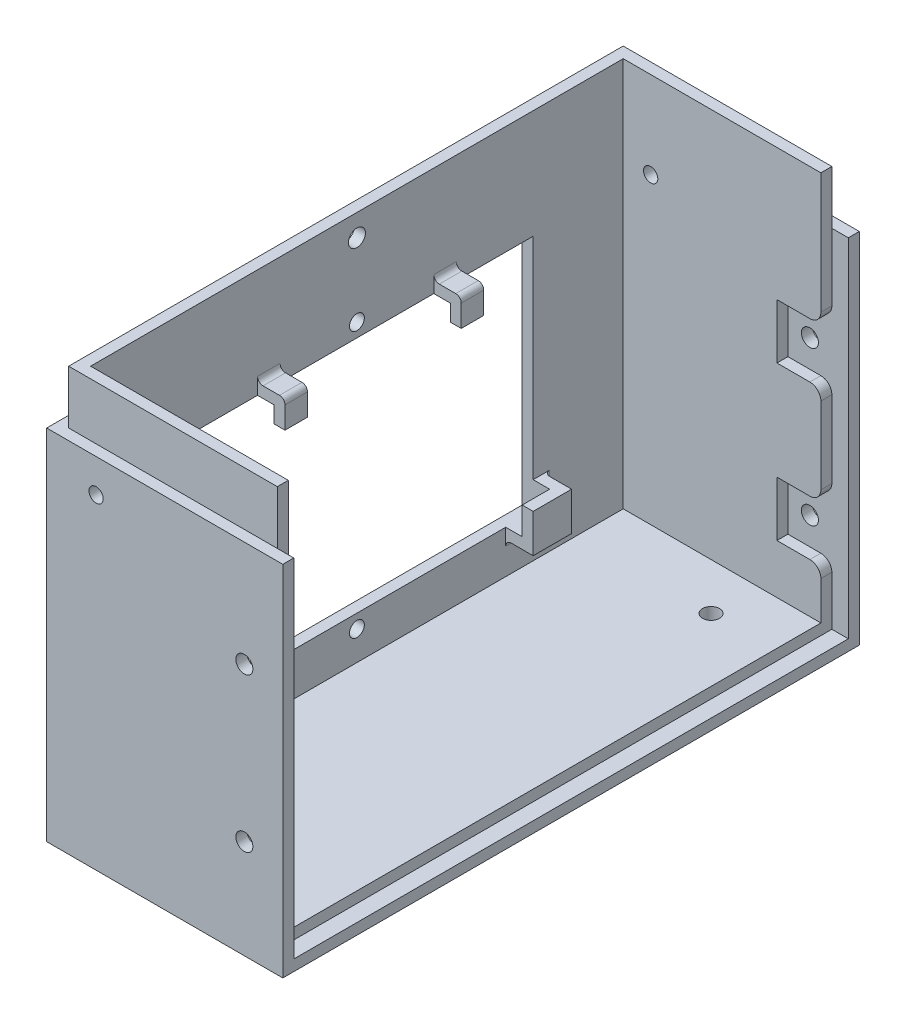
from build123d import *

# Parameters (mm, degrees)
COMBINE1_START         = 6.4842237
COMBINE1_DEPTH         = 32
COMBINE1_START_2       = 8.4842237
COMBINE1_2_OUTLINE_R   = 1.55
COMBINE1_2_OUTLINE_R_2 = 1.35
COMBINE1_2_OUTLINE_W   = 43.4
COMBINE1_2_OUTLINE_H   = 64.2
COMBINE1_2_OUTLINE_R_3 = 1.5
COMBINE1_2_DEPTH       = 2
COMBINE1_3_OUTLINE_W   = 61.2
COMBINE1_3_OUTLINE_H   = 97
COMBINE1_3_OUTLINE_W_2 = 53.4
COMBINE1_3_OUTLINE_H_2 = 74.2
COMBINE1_3_DEPTH       = 2
COMBINE1_START_3       = 10.4842237
COMBINE1_4_DEPTH       = 30.4499999
COMBINE1_START_4       = 44.0342238
COMBINE1_5_DEPTH       = 2.4499999
COMBINE1_START_5       = 38.4842237
COMBINE1_6_OUTLINE_W   = 9.8
COMBINE1_6_OUTLINE_H   = 2
COMBINE1_6_DEPTH       = 8
COMBINE1_START_6       = 35.844889136
COMBINE1_7_OUTLINE_W   = 3.1000002
COMBINE1_7_OUTLINE_H   = 4
COMBINE1_7_DEPTH       = 105
COMBINE1_8_OUTLINE_W   = 3.1000002
COMBINE1_8_OUTLINE_H   = 18
COMBINE1_8_OUTLINE_H_2 = 14.2
COMBINE1_8_OUTLINE_H_3 = 9
COMBINE1_8_DEPTH       = 4
COMBINE1_START_7       = 136.844889136
COMBINE1_9_OUTLINE_W   = 3.1000002
COMBINE1_9_OUTLINE_H   = 18
COMBINE1_9_OUTLINE_H_2 = 14.2
COMBINE1_9_OUTLINE_H_3 = 9
COMBINE1_9_DEPTH       = 4
COMBINE1_10_DEPTH      = 2
COMBINE1_START_8       = 138.844889136
COMBINE1_11_DEPTH      = 2
BOSS_EXTRUDE1_DEPTH    = 3
SKETCH2_W              = 7
SKETCH2_H              = 7
BOSS_EXTRUDE2_DEPTH    = 2
SKETCH3_W              = 4.1
SKETCH3_H              = 2
BOSS_EXTRUDE3_DEPTH    = 3
SKETCH4_W              = 4.1
SKETCH4_H              = 5
BOSS_EXTRUDE4_DEPTH    = 2
CUT_EXTRUDE2_REACH     = 166.436
SKETCH5_R              = 1.55
SKETCH6_R              = 1.3
CUT_EXTRUDE3_DEPTH     = 147.367337693
BOSS_EXTRUDE5_DEPTH    = 0.05
SKETCH8_W              = 101
SKETCH8_H              = 2
BOSS_EXTRUDE6_DEPTH    = 3
FILLET1_R              = 2
FILLET2_R              = 1


with BuildPart() as part:
    # Combine1: read off the stored shape, not the designer's step
    # Combine1 outline → Combine1 (new body)
    with BuildSketch(Plane.YZ.offset(COMBINE1_START)):
        Polygon((80.961305028, 35.844889136), (80.961305028, 39.844889136), (19.761305028, 39.844889136), (19.761305028, 136.844889136), (80.961305028, 136.844889136), (80.961305028, 140.844889136), (15.761305028, 140.844889136), (15.761305028, 35.844889136), align=None)
    extrude(amount=COMBINE1_DEPTH)

    # Combine1 2 outline → Combine1 2 (add)
    with BuildSketch(Plane.YZ.offset(COMBINE1_START_2)):
        Polygon((80.961305028, 37.844889136), (90.761305028, 37.844889136), (90.761305028, 138.844889136), (80.961305028, 138.844889136), (80.961305028, 136.844889136), (19.761305028, 136.844889136), (19.761305028, 39.844889136), (80.961305028, 39.844889136), align=None)
        with Locations((86.761305028, 88.344889136)):
            Circle(COMBINE1_2_OUTLINE_R, mode=Mode.SUBTRACT)
        with Locations((73.461305028, 88.344889136)):
            Circle(COMBINE1_2_OUTLINE_R_2, mode=Mode.SUBTRACT)
        with Locations((49.261305028, 88.344889136)):
            Rectangle(COMBINE1_2_OUTLINE_W, COMBINE1_2_OUTLINE_H, mode=Mode.SUBTRACT)
        with Locations((49.261305028, 122.944889136)):
            Circle(COMBINE1_2_OUTLINE_R_3, mode=Mode.SUBTRACT)
        with Locations((25.061305028, 88.344889136)):
            Circle(COMBINE1_2_OUTLINE_R_2, mode=Mode.SUBTRACT)
    extrude(amount=COMBINE1_2_DEPTH)

    # Combine1 3 outline → Combine1 3 (add)
    with BuildSketch(Plane.YZ.offset(COMBINE1_START)):
        with Locations((50.361305028, 88.344889136)):
            Rectangle(COMBINE1_3_OUTLINE_W, COMBINE1_3_OUTLINE_H)
        with Locations((49.261305028, 88.344889136)):
            Rectangle(COMBINE1_3_OUTLINE_W_2, COMBINE1_3_OUTLINE_H_2, mode=Mode.SUBTRACT)
    extrude(amount=COMBINE1_3_DEPTH)

    # Combine1 4 outline → Combine1 4 (add)
    with BuildSketch(Plane.YZ.offset(COMBINE1_START_3)):
        Polygon((80.961305028, 37.844889136), (90.761305028, 37.844889136), (90.761305028, 39.844889136), (66.761305028, 39.844889136), (66.761305028, 37.844889136), (56.761305028, 37.844889136), (56.761305028, 39.844889136), (38.761305028, 39.844889136), (38.761305028, 37.844889136), (28.761305028, 37.844889136), (28.761305028, 39.844889136), (19.761305028, 39.844889136), (19.761305028, 136.844889136), (28.761305028, 136.844889136), (28.761305028, 138.844889136), (38.761305028, 138.844889136), (38.761305028, 136.844889136), (56.761305028, 136.844889136), (56.761305028, 138.844889136), (66.761305028, 138.844889136), (66.761305028, 136.844889136), (90.761305028, 136.844889136), (90.761305028, 138.844889136), (80.961305028, 138.844889136), (80.961305028, 140.844889136), (15.761305028, 140.844889136), (15.761305028, 35.844889136), (80.961305028, 35.844889136), align=None)
    extrude(amount=COMBINE1_4_DEPTH)



with BuildPart() as body_2:
    # Combine1 5 outline → Combine1 5 (new body)
    with BuildSketch(Plane.YZ.offset(COMBINE1_START_4)):
        Polygon((80.961305028, 37.844889136), (90.761305028, 37.844889136), (90.761305028, 39.844889136), (66.761305028, 39.844889136), (66.761305028, 37.844889136), (56.761305028, 37.844889136), (56.761305028, 39.844889136), (38.761305028, 39.844889136), (38.761305028, 37.844889136), (28.761305028, 37.844889136), (28.761305028, 39.844889136), (19.761305028, 39.844889136), (19.761305028, 136.844889136), (28.761305028, 136.844889136), (28.761305028, 138.844889136), (38.761305028, 138.844889136), (38.761305028, 136.844889136), (56.761305028, 136.844889136), (56.761305028, 138.844889136), (66.761305028, 138.844889136), (66.761305028, 136.844889136), (90.761305028, 136.844889136), (90.761305028, 138.844889136), (80.961305028, 138.844889136), (80.961305028, 140.844889136), (15.761305028, 140.844889136), (15.761305028, 35.844889136), (80.961305028, 35.844889136), align=None)
    extrude(amount=COMBINE1_5_DEPTH)


with BuildPart() as part_1:
    add(part.part)

    add(body_2.part)  # Combine1 6 merges body 2
    # Combine1 6 outline → Combine1 6 (add)
    with BuildSketch(Plane.YZ.offset(COMBINE1_START_5)):
        with Locations((85.861305028, 38.844889136)):
            Rectangle(COMBINE1_6_OUTLINE_W, COMBINE1_6_OUTLINE_H)
        with Locations((85.861305028, 137.844889136)):
            Rectangle(COMBINE1_6_OUTLINE_W, COMBINE1_6_OUTLINE_H)
    extrude(amount=COMBINE1_6_DEPTH)

    # Combine1 7 outline → Combine1 7 (add)
    with BuildSketch(Plane.XY.offset(COMBINE1_START_6)):
        with Locations((42.4842237, 17.761305028)):
            Rectangle(COMBINE1_7_OUTLINE_W, COMBINE1_7_OUTLINE_H)
    extrude(amount=COMBINE1_7_DEPTH)

    # Combine1 8 outline → Combine1 8 (add)
    with BuildSketch(Plane.XY.offset(COMBINE1_START_6)):
        with Locations((42.4842237, 47.761305028)):
            Rectangle(COMBINE1_8_OUTLINE_W, COMBINE1_8_OUTLINE_H)
        with Locations((42.4842237, 73.861305028)):
            Rectangle(COMBINE1_8_OUTLINE_W, COMBINE1_8_OUTLINE_H_2)
        with Locations((42.4842237, 24.261305028)):
            Rectangle(COMBINE1_8_OUTLINE_W, COMBINE1_8_OUTLINE_H_3)
    extrude(amount=COMBINE1_8_DEPTH)

    # Combine1 9 outline → Combine1 9 (add)
    with BuildSketch(Plane.XY.offset(COMBINE1_START_7)):
        with Locations((42.4842237, 47.761305028)):
            Rectangle(COMBINE1_9_OUTLINE_W, COMBINE1_9_OUTLINE_H)
        with Locations((42.4842237, 73.861305028)):
            Rectangle(COMBINE1_9_OUTLINE_W, COMBINE1_9_OUTLINE_H_2)
        with Locations((42.4842237, 24.261305028)):
            Rectangle(COMBINE1_9_OUTLINE_W, COMBINE1_9_OUTLINE_H_3)
    extrude(amount=COMBINE1_9_DEPTH)

    # Combine1 10 outline → Combine1 10 (add)
    with BuildSketch(Plane.XY.offset(COMBINE1_START_6)):
        with BuildLine():
            Line((44.0342238, 56.761305028), (44.0342237, 61.761305028))
            ThreePointArc((44.0342237, 61.761305028), (42.4842237, 60.211305028), (40.9342237, 61.761305028))
            Line((40.9342237, 61.761305028), (40.9342236, 56.761305028))
            Line((40.9342236, 56.761305028), (44.0342238, 56.761305028))
        make_face()
        with BuildLine():
            ThreePointArc((40.9342237, 61.761305028), (42.4842237, 63.311305028), (44.0342237, 61.761305028))
            Line((44.0342237, 61.761305028), (44.0342238, 66.761305028))
            Line((44.0342238, 66.761305028), (40.9342236, 66.761305028))
            Line((40.9342236, 66.761305028), (40.9342237, 61.761305028))
        make_face()
        with BuildLine():
            Line((44.0342237, 33.761305028), (44.0342238, 38.761305028))
            Line((44.0342238, 38.761305028), (40.9342236, 38.761305028))
            Line((40.9342236, 38.761305028), (40.9342237, 33.761305028))
            ThreePointArc((40.9342237, 33.761305028), (42.4842237, 35.311305028), (44.0342237, 33.761305028))
        make_face()
        with BuildLine():
            Line((44.0342238, 28.761305028), (44.0342237, 33.761305028))
            ThreePointArc((44.0342237, 33.761305028), (42.4842237, 32.211305028), (40.9342237, 33.761305028))
            Line((40.9342237, 33.761305028), (40.9342236, 28.761305028))
            Line((40.9342236, 28.761305028), (44.0342238, 28.761305028))
        make_face()
    extrude(amount=COMBINE1_10_DEPTH)

    # Combine1 11 outline → Combine1 11 (add)
    with BuildSketch(Plane.XY.offset(COMBINE1_START_8)):
        with BuildLine():
            Line((44.0342238, 56.761305028), (44.0342237, 61.761305028))
            ThreePointArc((44.0342237, 61.761305028), (42.4842237, 60.211305028), (40.9342237, 61.761305028))
            Line((40.9342237, 61.761305028), (40.9342236, 56.761305028))
            Line((40.9342236, 56.761305028), (44.0342238, 56.761305028))
        make_face()
        with BuildLine():
            ThreePointArc((40.9342237, 61.761305028), (42.4842237, 63.311305028), (44.0342237, 61.761305028))
            Line((44.0342237, 61.761305028), (44.0342238, 66.761305028))
            Line((44.0342238, 66.761305028), (40.9342236, 66.761305028))
            Line((40.9342236, 66.761305028), (40.9342237, 61.761305028))
        make_face()
        with BuildLine():
            Line((44.0342237, 33.761305028), (44.0342238, 38.761305028))
            Line((44.0342238, 38.761305028), (40.9342236, 38.761305028))
            Line((40.9342236, 38.761305028), (40.9342237, 33.761305028))
            ThreePointArc((40.9342237, 33.761305028), (42.4842237, 35.311305028), (44.0342237, 33.761305028))
        make_face()
        with BuildLine():
            Line((44.0342238, 28.761305028), (44.0342237, 33.761305028))
            ThreePointArc((44.0342237, 33.761305028), (42.4842237, 32.211305028), (40.9342237, 33.761305028))
            Line((40.9342237, 33.761305028), (40.9342236, 28.761305028))
            Line((40.9342236, 28.761305028), (44.0342238, 28.761305028))
        make_face()
    extrude(amount=COMBINE1_11_DEPTH)

    # Sketch1 → Boss-Extrude1 (add)
    with BuildSketch(Plane(origin=(10.4842237, 0, 0), x_dir=(0, 0, -1), z_dir=(1, 0, 0))):
        Polygon((-120.444889136, 27.561305028), (-120.444889136, 32.561305028), (-122.444889136, 32.561305028), (-122.444889136, 27.561305028), (-122.444889136, 25.561305028), (-115.444889136, 25.561305028), (-115.444889136, 27.561305028), align=None)
        Polygon((-56.244889136, 27.561305028), (-61.244889136, 27.561305028), (-61.244889136, 25.561305028), (-54.244889136, 25.561305028), (-54.244889136, 27.561305028), (-54.244889136, 32.561305028), (-56.244889136, 32.561305028), align=None)
    extrude(amount=BOSS_EXTRUDE1_DEPTH)

    # Sketch2 → Boss-Extrude2 (add)
    with BuildSketch(Plane(origin=(13.4842237, 0, 0), x_dir=(0, 0, -1), z_dir=(1, 0, 0))):
        with Locations((-118.944889136, 29.061305028)):
            Rectangle(SKETCH2_W, SKETCH2_H)
        with Locations((-57.744889136, 29.061305028)):
            Rectangle(SKETCH2_W, SKETCH2_H)
    extrude(amount=BOSS_EXTRUDE2_DEPTH)

    # Sketch3 → Boss-Extrude3 (add)
    with BuildSketch(Plane(origin=(10.4842237, 0, 0), x_dir=(0, 0, -1), z_dir=(1, 0, 0))):
        with Locations((-104.394889136, 71.961305028)):
            Rectangle(SKETCH3_W, SKETCH3_H)
        with Locations((-72.294889136, 71.961305028)):
            Rectangle(SKETCH3_W, SKETCH3_H)
    extrude(amount=BOSS_EXTRUDE3_DEPTH)

    # Sketch4 → Boss-Extrude4 (add)
    with BuildSketch(Plane(origin=(13.4842237, 0, 0), x_dir=(0, 0, -1), z_dir=(1, 0, 0))):
        with Locations((-104.394889136, 70.461305028)):
            Rectangle(SKETCH4_W, SKETCH4_H)
        with Locations((-72.294889136, 70.461305028)):
            Rectangle(SKETCH4_W, SKETCH4_H)
    extrude(amount=BOSS_EXTRUDE4_DEPTH)

    # Sketch5 → Cut-Extrude2 (cut, up to next)
    with BuildSketch(Plane(origin=(0, 19.761305028, 0), x_dir=(1, 0, 0), z_dir=(0, 1, 0)), mode=Mode.PRIVATE) as cut_extrude2_sk1:
        with Locations(Location((34.9842237, -48.344889136, 0), (0, 0, 270))):
            Circle(SKETCH5_R)
    cut_extrude2_tool1 = extrude(cut_extrude2_sk1.sketch, amount=-CUT_EXTRUDE2_REACH, mode=Mode.PRIVATE) & part_1.part
    # Sketch5 → Cut-Extrude2 (cut, up to next)
    with BuildSketch(Plane(origin=(0, 19.761305028, 0), x_dir=(1, 0, 0), z_dir=(0, 1, 0)), mode=Mode.PRIVATE) as cut_extrude2_sk2:
        with Locations(Location((34.9842237, -128.344889136, 0), (0, 0, 270))):
            Circle(SKETCH5_R)
    cut_extrude2_tool2 = extrude(cut_extrude2_sk2.sketch, amount=-CUT_EXTRUDE2_REACH, mode=Mode.PRIVATE) & part_1.part
    add(cut_extrude2_tool1.solids().sort_by_distance((34.984224, 19.761305, 48.344889))[0], mode=Mode.SUBTRACT)
    add(cut_extrude2_tool2.solids().sort_by_distance((34.984224, 19.761305, 128.344889))[0], mode=Mode.SUBTRACT)

    # Sketch6 → Cut-Extrude3 (cut, through all)
    with BuildSketch(Plane.XY.offset(140.844889136)):
        with Locations((15.4842237, 74.961305028)):
            Circle(SKETCH6_R)
    extrude(amount=-CUT_EXTRUDE3_DEPTH, mode=Mode.SUBTRACT)

    # Sketch7 → Boss-Extrude5 (add)
    with BuildSketch(Plane(origin=(0, 80.961305028, 0), x_dir=(1, 0, 0), z_dir=(0, 1, 0))):
        Polygon((46.4842237, -37.844889136), (8.4842237, -37.844889136), (8.4842237, -138.844889136), (46.4842237, -138.844889136), (46.4842237, -140.844889136), (6.4842237, -140.844889136), (6.4842237, -138.844889136), (6.4842237, -37.844889136), (6.4842237, -35.844889136), (46.4842237, -35.844889136), align=None)
    extrude(amount=BOSS_EXTRUDE5_DEPTH)

    # Sketch8 → Boss-Extrude6 (add)
    with BuildSketch(Plane(origin=(46.4842237, 0, 0), x_dir=(0, 0, -1), z_dir=(1, 0, 0))):
        with Locations((-88.344889136, 16.761305028)):
            Rectangle(SKETCH8_W, SKETCH8_H)
        Polygon((-138.844889136, 66.761305028), (-138.844889136, 81.011305028), (-140.844889136, 81.011305028), (-140.844889136, 15.761305028), (-138.844889136, 15.761305028), (-138.844889136, 17.761305028), (-138.844889136, 28.761305028), (-138.844889136, 38.761305028), (-138.844889136, 56.761305028), align=None)
        Polygon((-37.844889136, 17.761305028), (-37.844889136, 15.761305028), (-35.844889136, 15.761305028), (-35.844889136, 81.011305028), (-37.844889136, 81.011305028), (-37.844889136, 66.761305028), (-37.844889136, 56.761305028), (-37.844889136, 38.761305028), (-37.844889136, 28.761305028), align=None)
    extrude(amount=BOSS_EXTRUDE6_DEPTH)

    # Fillet1
    fillet1_edges = [part_1.edges().sort_by_distance(p)[0] for p in [
        (46.4842237, 56.761305028, 137.844889136),
        (46.4842237, 66.761305028, 137.844889136),
        (46.4842237, 66.761305028, 38.844889136),
        (46.4842237, 56.761305028, 38.844889136),
        (46.4842237, 38.761305028, 38.844889136),
        (46.4842237, 28.761305028, 38.844889136),
        (46.4842237, 28.761305028, 137.844889136),
        (46.4842237, 38.761305028, 137.844889136),
    ]]
    fillet(fillet1_edges, radius=FILLET1_R)

    # Fillet2
    fillet2_edges = [part_1.edges().sort_by_distance(p)[0] for p in [
        (10.4842237, 29.061305028, 122.444889136),
        (10.4842237, 25.561305028, 118.944889136),
        (10.4842237, 25.561305028, 57.744889136),
        (10.4842237, 29.061305028, 54.244889136),
        (10.4842237, 72.961305028, 104.394889136),
        (10.4842237, 72.961305028, 72.294889136),
        (15.4842237, 72.961305028, 104.394889136),
        (15.4842237, 72.961305028, 72.294889136),
    ]]
    fillet(fillet2_edges, radius=FILLET2_R)


solid = part_1.part
